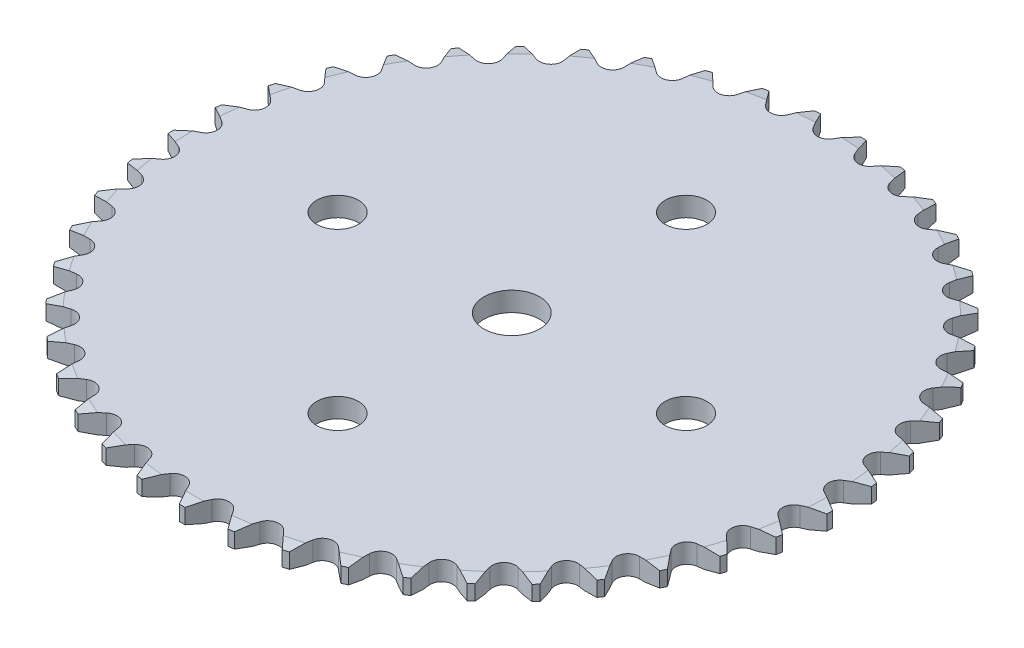
from build123d import *

# Parameters (mm, degrees)
CUT_EXTRUDE1_REACH = 71.565
CIRPATTERN1_START  = -2.794
CIRPATTERN1_DEPTH  = 2.794
SKETCH3_R          = 4
CUT_EXTRUDE2_DEPTH = 70.554033029
SKETCH4_R          = 25.4
CUT_EXTRUDE3_DEPTH = 16.256
SKETCH5_R          = 3
CUT_EXTRUDE4_DEPTH = 10


# Read off the part's stored shape, not the designer's step: CirPattern1
with BuildPart() as part:
    # Sketch1 → Revolve2 (revolve)
    with BuildSketch(Plane.XY, mode=Mode.PRIVATE) as revolve2_sk:
        Polygon((0, 0), (45.515488808, 0), (47.309615365, -0.316352919), (47.309615365, -2.477647081), (45.515488808, -2.794), (25.4, -2.794), (25.4, -18.55), (24.9, -19.05), (0, -19.05), align=None)
    revolve(revolve2_sk.sketch.rotate(Axis((0, 0, 0), (0, -1, 0)), 180), axis=Axis((0, 0, 0), (0, -1, 0)))

    # Cut-Extrude1: up to this face of the body (flat: up to its plane)
    cut_extrude1_end = Plane(part.part.faces().sort_by_distance((44.228116377, -2.794, 0))[0])
    # Sketch2 → Cut-Extrude1 (cut, up to the picked face)
    with BuildSketch(Plane(origin=(0, 0, 0), x_dir=(1, 0, 0), z_dir=(0, 1, 0)), mode=Mode.PRIVATE) as cut_extrude1_sk1:
        with BuildLine():
            Line((1.428941916, 44.690488808), (2.890081741, 47.221257221))
            ThreePointArc((2.890081741, 47.221257221), (0, 47.309615365), (-2.890081741, 47.221257221))
            Line((-2.890081741, 47.221257221), (-1.428941916, 44.690488808))
            ThreePointArc((-1.428941916, 44.690488808), (0, 43.865488808), (1.428941916, 44.690488808))
        make_face()
    cut_extrude1_tool1 = split(extrude(cut_extrude1_sk1.sketch, amount=-CUT_EXTRUDE1_REACH, mode=Mode.PRIVATE), bisect_by=cut_extrude1_end, keep=Keep.BOTH, mode=Mode.PRIVATE)
    add(cut_extrude1_tool1.solids().sort_by(Axis((0, 0, -45.903425), (0, -1, 0)))[0], mode=Mode.SUBTRACT)

    # CirPattern1 outline → CirPattern1 (cut)
    with BuildSketch(Plane(origin=(0, 0, 0), x_dir=(1, 0, 0), z_dir=(0, 1, 0)).offset(CIRPATTERN1_START)):
        with BuildLine():
            ThreePointArc((-42.339849222, -21.107744404), (-40.971328749, -23.654807683), (-39.449767482, -26.113512817))
            Line((-39.449767482, -26.113512817), (-37.988627657, -23.582744404))
            ThreePointArc((-37.988627657, -23.582744404), (-37.988627657, -21.932744404), (-39.417569574, -21.107744404))
            Line((-39.417569574, -21.107744404), (-42.339849222, -21.107744404))
        make_face()
        with BuildLine():
            ThreePointArc((-3.709973135, 47.16392483), (-6.584225875, 46.849201441), (-9.433884462, 46.359481554))
            Line((-9.433884462, 46.359481554), (-7.634749463, 44.056693766))
            ThreePointArc((-7.634749463, 44.056693766), (-6.104896103, 43.438592886), (-4.804678359, 44.454434321))
            Line((-4.804678359, 44.454434321), (-3.709973135, 47.16392483))
        make_face()
        with BuildLine():
            ThreePointArc((-10.237817603, 46.18860029), (-13.040297284, 45.4769211), (-15.794067354, 44.595371312))
            Line((-15.794067354, 44.595371312), (-13.691955295, 42.565385293))
            ThreePointArc((-13.691955295, 42.565385293), (-12.090967347, 42.166214165), (-10.944781035, 43.353124835))
            Line((-10.944781035, 43.353124835), (-10.237817603, 46.18860029))
        make_face()
        with BuildLine():
            ThreePointArc((-16.566394598, 44.314267184), (-19.242554139, 43.21948422), (-21.84683669, 41.963262893))
            Line((-21.84683669, 41.963262893), (-19.482662792, 40.245590012))
            ThreePointArc((-19.482662792, 40.245590012), (-17.841701664, 40.073118048), (-16.871855998, 41.407996089))
            Line((-16.871855998, 41.407996089), (-16.566394598, 44.314267184))
        make_face()
        with BuildLine():
            ThreePointArc((-22.572525565, 41.577407274), (-25.070276566, 40.12082924), (-27.474382201, 38.514387295))
            Line((-27.474382201, 38.514387295), (-24.894162419, 37.142460101))
            ThreePointArc((-24.894162419, 37.142460101), (-23.245167554, 37.200044271), (-22.470539476, 38.656907799))
            Line((-22.470539476, 38.656907799), (-22.572525565, 41.577407274))
        make_face()
        with BuildLine():
            ThreePointArc((-28.139307998, 38.031290425), (-30.410034576, 36.241267956), (-32.567170113, 34.315872957))
            Line((-32.567170113, 34.315872957), (-29.821125491, 33.316394453))
            ThreePointArc((-29.821125491, 33.316394453), (-28.196192698, 33.602913946), (-27.631859462, 35.153406771))
            Line((-27.631859462, 35.153406771), (-28.139307998, 38.031290425))
        make_face()
        with BuildLine():
            ThreePointArc((-33.158390809, 33.744937768), (-35.157895854, 31.656311616), (-37.026075104, 29.449439187))
            Line((-37.026075104, 29.449439187), (-34.167654277, 28.841863084))
            ThreePointArc((-34.167654277, 28.841863084), (-32.598411025, 29.351741124), (-32.255356735, 30.965684666))
            Line((-32.255356735, 30.965684666), (-33.158390809, 33.744937768))
        make_face()
        with BuildLine():
            ThreePointArc((-37.53208326, 28.801778282), (-39.221448681, 26.455201178), (-40.764309659, 24.00980558))
            Line((-40.764309659, 24.00980558), (-37.849148537, 23.805957657))
            ThreePointArc((-37.849148537, 23.805957657), (-36.36613836, 24.529270049), (-36.251040179, 26.175250732))
            Line((-36.251040179, 26.175250732), (-37.53208326, 28.801778282))
        make_face()
        with BuildLine():
            ThreePointArc((-41.175256402, 23.298024942), (-42.521600623, 20.739170342), (-43.709113296, 18.102848419))
            Line((-43.709113296, 18.102848419), (-40.793952174, 18.306696343))
            ThreePointArc((-40.793952174, 18.306696343), (-39.426040179, 19.229364633), (-39.54113836, 20.875345316))
            Line((-39.54113836, 20.875345316), (-41.175256402, 23.298024942))
        make_face()
        with BuildLine():
            ThreePointArc((-44.017000015, 17.340802049), (-44.994117976, 14.619475145), (-45.803168761, 11.843539905))
            Line((-45.803168761, 11.843539905), (-42.944747934, 12.451116008))
            ThreePointArc((-42.944747934, 12.451116008), (-41.718558972, 13.555181509), (-42.061613261, 15.16912505))
            Line((-42.061613261, 15.16912505), (-44.017000015, 17.340802049))
        make_face()
        with BuildLine():
            ThreePointArc((-46.002002791, 11.046060169), (-46.590876004, 8.215228495), (-47.005717646, 5.353710359))
            Line((-47.005717646, 5.353710359), (-44.259673024, 6.353188863))
            ThreePointArc((-44.259673024, 6.353188863), (-43.199073468, 7.617162194), (-43.763406704, 9.167655018))
            Line((-43.763406704, 9.167655018), (-46.002002791, 11.046060169))
        make_face()
        with BuildLine():
            ThreePointArc((-47.091628909, 4.536319292), (-47.280795626, 1.651081766), (-47.293353705, -1.24032307))
            Line((-47.293353705, -1.24032307), (-44.713133924, 0.131604123))
            ThreePointArc((-44.713133924, 0.131604123), (-43.838767138, 1.530883482), (-44.613395216, 2.98774701))
            Line((-44.613395216, 2.98774701), (-47.091628909, 4.536319292))
        make_face()
        with BuildLine():
            ThreePointArc((-47.264670036, -2.06171588), (-47.050448342, -4.945201392), (-46.66047843, -7.810215021))
            Line((-46.66047843, -7.810215021), (-44.296304532, -6.092542141))
            ThreePointArc((-44.296304532, -6.092542141), (-43.625189071, -4.585192136), (-44.595034737, -3.250314095))
            Line((-44.595034737, -3.250314095), (-47.264670036, -2.06171588))
        make_face()
        with BuildLine():
            ThreePointArc((-46.517758124, -8.619622098), (-45.9043176, -11.445231829), (-45.119410018, -14.228090021))
            Line((-45.119410018, -14.228090021), (-43.017297959, -12.198104002))
            ThreePointArc((-43.017297959, -12.198104002), (-42.562496322, -10.612022204), (-43.708682633, -9.425111533))
            Line((-43.708682633, -9.425111533), (-46.517758124, -8.619622098))
        make_face()
        with BuildLine():
            ThreePointArc((-44.865430963, -15.009757176), (-43.864711532, -17.722493848), (-42.700143612, -20.369031433))
            Line((-42.700143612, -20.369031433), (-40.901008612, -18.066243644))
            ThreePointArc((-40.901008612, -18.066243644), (-40.671372996, -16.432301331), (-41.971590739, -15.416459897))
            Line((-41.971590739, -15.416459897), (-44.865430963, -15.009757176))
        make_face()
        with BuildLine():
            Line((7.634749463, 44.056693766), (9.433884462, 46.359481554))
            ThreePointArc((9.433884462, 46.359481554), (6.584225875, 46.849201441), (3.709973135, 47.16392483))
            Line((3.709973135, 47.16392483), (4.804678359, 44.454434321))
            ThreePointArc((4.804678359, 44.454434321), (6.104896103, 43.438592886), (7.634749463, 44.056693766))
        make_face()
        with BuildLine():
            Line((13.691955295, 42.565385293), (15.794067354, 44.595371312))
            ThreePointArc((15.794067354, 44.595371312), (13.040297284, 45.4769211), (10.237817603, 46.18860029))
            Line((10.237817603, 46.18860029), (10.944781035, 43.353124835))
            ThreePointArc((10.944781035, 43.353124835), (12.090967347, 42.166214165), (13.691955295, 42.565385293))
        make_face()
        with BuildLine():
            Line((19.482662792, 40.245590012), (21.84683669, 41.963262893))
            ThreePointArc((21.84683669, 41.963262893), (19.242554139, 43.21948422), (16.566394598, 44.314267184))
            Line((16.566394598, 44.314267184), (16.871855998, 41.407996089))
            ThreePointArc((16.871855998, 41.407996089), (17.841701664, 40.073118048), (19.482662792, 40.245590012))
        make_face()
        with BuildLine():
            Line((24.894162419, 37.142460101), (27.474382201, 38.514387295))
            ThreePointArc((27.474382201, 38.514387295), (25.070276566, 40.12082924), (22.572525565, 41.577407274))
            Line((22.572525565, 41.577407274), (22.470539476, 38.656907799))
            ThreePointArc((22.470539476, 38.656907799), (23.245167554, 37.200044271), (24.894162419, 37.142460101))
        make_face()
        with BuildLine():
            Line((29.821125491, 33.316394453), (32.567170113, 34.315872957))
            ThreePointArc((32.567170113, 34.315872957), (30.410034576, 36.241267956), (28.139307998, 38.031290425))
            Line((28.139307998, 38.031290425), (27.631859462, 35.153406771))
            ThreePointArc((27.631859462, 35.153406771), (28.196192698, 33.602913946), (29.821125491, 33.316394453))
        make_face()
        with BuildLine():
            Line((34.167654277, 28.841863084), (37.026075104, 29.449439187))
            ThreePointArc((37.026075104, 29.449439187), (35.157895854, 31.656311616), (33.158390809, 33.744937768))
            Line((33.158390809, 33.744937768), (32.255356735, 30.965684666))
            ThreePointArc((32.255356735, 30.965684666), (32.598411025, 29.351741124), (34.167654277, 28.841863084))
        make_face()
        with BuildLine():
            Line((37.849148537, 23.805957657), (40.764309659, 24.00980558))
            ThreePointArc((40.764309659, 24.00980558), (39.221448681, 26.455201178), (37.53208326, 28.801778282))
            Line((37.53208326, 28.801778282), (36.251040179, 26.175250732))
            ThreePointArc((36.251040179, 26.175250732), (36.36613836, 24.529270049), (37.849148537, 23.805957657))
        make_face()
        with BuildLine():
            Line((40.793952174, 18.306696343), (43.709113296, 18.102848419))
            ThreePointArc((43.709113296, 18.102848419), (42.521600623, 20.739170342), (41.175256402, 23.298024942))
            Line((41.175256402, 23.298024942), (39.54113836, 20.875345316))
            ThreePointArc((39.54113836, 20.875345316), (39.426040179, 19.229364633), (40.793952174, 18.306696343))
        make_face()
        with BuildLine():
            Line((42.944747934, 12.451116008), (45.803168761, 11.843539905))
            ThreePointArc((45.803168761, 11.843539905), (44.994117976, 14.619475145), (44.017000015, 17.340802049))
            Line((44.017000015, 17.340802049), (42.061613261, 15.16912505))
            ThreePointArc((42.061613261, 15.16912505), (41.718558972, 13.555181509), (42.944747934, 12.451116008))
        make_face()
        with BuildLine():
            Line((44.259673024, 6.353188863), (47.005717646, 5.353710359))
            ThreePointArc((47.005717646, 5.353710359), (46.590876004, 8.215228495), (46.002002791, 11.046060169))
            Line((46.002002791, 11.046060169), (43.763406704, 9.167655018))
            ThreePointArc((43.763406704, 9.167655018), (43.199073468, 7.617162194), (44.259673024, 6.353188863))
        make_face()
        with BuildLine():
            Line((44.713133924, 0.131604123), (47.293353705, -1.24032307))
            ThreePointArc((47.293353705, -1.24032307), (47.280795626, 1.651081766), (47.091628909, 4.536319292))
            Line((47.091628909, 4.536319292), (44.613395216, 2.98774701))
            ThreePointArc((44.613395216, 2.98774701), (43.838767138, 1.530883482), (44.713133924, 0.131604123))
        make_face()
        with BuildLine():
            Line((44.296304532, -6.092542141), (46.66047843, -7.810215021))
            ThreePointArc((46.66047843, -7.810215021), (47.050448342, -4.945201392), (47.264670036, -2.06171588))
            Line((47.264670036, -2.06171588), (44.595034737, -3.250314095))
            ThreePointArc((44.595034737, -3.250314095), (43.625189071, -4.585192136), (44.296304532, -6.092542141))
        make_face()
        with BuildLine():
            Line((43.017297959, -12.198104002), (45.119410018, -14.228090021))
            ThreePointArc((45.119410018, -14.228090021), (45.9043176, -11.445231829), (46.517758124, -8.619622098))
            Line((46.517758124, -8.619622098), (43.708682633, -9.425111533))
            ThreePointArc((43.708682633, -9.425111533), (42.562496322, -10.612022204), (43.017297959, -12.198104002))
        make_face()
        with BuildLine():
            Line((40.901008612, -18.066243644), (42.700143612, -20.369031433))
            ThreePointArc((42.700143612, -20.369031433), (43.864711532, -17.722493848), (44.865430963, -15.009757176))
            Line((44.865430963, -15.009757176), (41.971590739, -15.416459897))
            ThreePointArc((41.971590739, -15.416459897), (40.671372996, -16.432301331), (40.901008612, -18.066243644))
        make_face()
        with BuildLine():
            Line((37.988627657, -23.582744404), (39.449767482, -26.113512817))
            ThreePointArc((39.449767482, -26.113512817), (40.971328749, -23.654807683), (42.339849222, -21.107744404))
            Line((42.339849222, -21.107744404), (39.417569574, -21.107744404))
            ThreePointArc((39.417569574, -21.107744404), (37.988627657, -21.932744404), (37.988627657, -23.582744404))
        make_face()
        with BuildLine():
            Line((34.336841276, -28.640233869), (35.431546501, -31.349724378))
            ThreePointArc((35.431546501, -31.349724378), (37.280485657, -29.126707593), (38.990170477, -26.794893397))
            Line((38.990170477, -26.794893397), (36.096330253, -26.388190676))
            ThreePointArc((36.096330253, -26.388190676), (34.566476893, -27.006291556), (34.336841276, -28.640233869))
        make_face()
        with BuildLine():
            Line((30.016727338, -33.140273759), (30.72369077, -35.975749213))
            ThreePointArc((30.72369077, -35.975749213), (32.864020316, -34.031689271), (34.881592414, -31.960510269))
            Line((34.881592414, -31.960510269), (32.072516923, -31.155020833))
            ThreePointArc((32.072516923, -31.155020833), (30.471528975, -31.554191961), (30.016727338, -33.140273759))
        make_face()
        with BuildLine():
            Line((25.112371945, -36.995275918), (25.417833346, -39.901547012))
            ThreePointArc((25.417833346, -39.901547012), (27.807894203, -38.274282828), (30.094083832, -36.504052162))
            Line((30.094083832, -36.504052162), (27.424448533, -35.315453948))
            ThreePointArc((27.424448533, -35.315453948), (25.783487405, -35.487925912), (25.112371945, -36.995275918))
        make_face()
        with BuildLine():
            Line((19.719232797, -40.130207111), (19.617246708, -43.050706586))
            ThreePointArc((19.617246708, -43.050706586), (22.21051906, -41.771911006), (24.72082814, -40.337084204))
            Line((24.72082814, -40.337084204), (22.242594448, -38.788511922))
            ThreePointArc((22.242594448, -38.788511922), (20.593599583, -38.730927753), (19.719232797, -40.130207111))
        make_face()
        with BuildLine():
            Line((13.942281213, -42.484049471), (13.434832678, -45.361933126))
            ThreePointArc((13.434832678, -45.361933126), (16.180841428, -44.456496451), (18.866409648, -43.385000784))
            Line((18.866409648, -43.385000784), (16.627813562, -41.506595633))
            ThreePointArc((16.627813562, -41.506595633), (15.002880769, -41.22007614), (13.942281213, -42.484049471))
        make_face()
        with BuildLine():
            Line((7.893958985, -44.010988133), (6.990924911, -46.790241235))
            ThreePointArc((6.990924911, -46.790241235), (9.836222123, -46.275786761), (12.644777952, -45.588477673))
            Line((12.644777952, -45.588477673), (10.689391199, -43.416800673))
            ThreePointArc((10.689391199, -43.416800673), (9.120147947, -42.906922633), (7.893958985, -44.010988133))
        make_face()
        with BuildLine():
            Line((1.691989824, -44.681302973), (0.410946743, -47.307830523))
            ThreePointArc((0.410946743, -47.307830523), (3.300151942, -47.19437152), (6.177030036, -46.904626701))
            Line((6.177030036, -46.904626701), (4.542911995, -44.481947074))
            ThreePointArc((4.542911995, -44.481947074), (3.059901819, -43.758634682), (1.691989824, -44.681302973))
        make_face()
        with BuildLine():
            Line((-4.542911995, -44.481947074), (-6.177030036, -46.904626701))
            ThreePointArc((-6.177030036, -46.904626701), (-3.300151942, -47.19437152), (-0.410946743, -47.307830523))
            Line((-0.410946743, -47.307830523), (-1.691989824, -44.681302973))
            ThreePointArc((-1.691989824, -44.681302973), (-3.059901819, -43.758634682), (-4.542911995, -44.481947074))
        make_face()
        with BuildLine():
            Line((-10.689391199, -43.416800673), (-12.644777952, -45.588477673))
            ThreePointArc((-12.644777952, -45.588477673), (-9.836222123, -46.275786761), (-6.990924911, -46.790241235))
            Line((-6.990924911, -46.790241235), (-7.893958985, -44.010988133))
            ThreePointArc((-7.893958985, -44.010988133), (-9.120147947, -42.906922633), (-10.689391199, -43.416800673))
        make_face()
        with BuildLine():
            Line((-16.627813562, -41.506595633), (-18.866409648, -43.385000784))
            ThreePointArc((-18.866409648, -43.385000784), (-16.180841428, -44.456496451), (-13.434832678, -45.361933126))
            Line((-13.434832678, -45.361933126), (-13.942281213, -42.484049471))
            ThreePointArc((-13.942281213, -42.484049471), (-15.002880769, -41.22007614), (-16.627813562, -41.506595633))
        make_face()
        with BuildLine():
            Line((-22.242594448, -38.788511922), (-24.72082814, -40.337084204))
            ThreePointArc((-24.72082814, -40.337084204), (-22.21051906, -41.771911006), (-19.617246708, -43.050706586))
            Line((-19.617246708, -43.050706586), (-19.719232797, -40.130207111))
            ThreePointArc((-19.719232797, -40.130207111), (-20.593599583, -38.730927753), (-22.242594448, -38.788511922))
        make_face()
        with BuildLine():
            Line((-27.424448533, -35.315453948), (-30.094083832, -36.504052162))
            ThreePointArc((-30.094083832, -36.504052162), (-27.807894203, -38.274282828), (-25.417833346, -39.901547012))
            Line((-25.417833346, -39.901547012), (-25.112371945, -36.995275918))
            ThreePointArc((-25.112371945, -36.995275918), (-25.783487405, -35.487925912), (-27.424448533, -35.315453948))
        make_face()
        with BuildLine():
            Line((-32.072516923, -31.155020833), (-34.881592414, -31.960510269))
            ThreePointArc((-34.881592414, -31.960510269), (-32.864020316, -34.031689271), (-30.72369077, -35.975749213))
            Line((-30.72369077, -35.975749213), (-30.016727338, -33.140273759))
            ThreePointArc((-30.016727338, -33.140273759), (-30.471528975, -31.554191961), (-32.072516923, -31.155020833))
        make_face()
        with BuildLine():
            Line((-36.096330253, -26.388190676), (-38.990170477, -26.794893397))
            ThreePointArc((-38.990170477, -26.794893397), (-37.280485657, -29.126707593), (-35.431546501, -31.349724378))
            Line((-35.431546501, -31.349724378), (-34.336841276, -28.640233869))
            ThreePointArc((-34.336841276, -28.640233869), (-34.566476893, -27.006291556), (-36.096330253, -26.388190676))
        make_face()
    extrude(amount=CIRPATTERN1_DEPTH, mode=Mode.SUBTRACT)

    # Sketch3 → Cut-Extrude2 (cut, through all)
    with BuildSketch(Plane.XZ.offset(19.05)):
        Circle(SKETCH3_R)
    extrude(amount=-CUT_EXTRUDE2_DEPTH, mode=Mode.SUBTRACT)

    # Sketch4 → Cut-Extrude3 (cut)
    with BuildSketch(Plane.XZ.offset(19.05)):
        Circle(SKETCH4_R)
    extrude(amount=-CUT_EXTRUDE3_DEPTH, mode=Mode.SUBTRACT)

    # Sketch5 → Cut-Extrude4 (cut)
    with BuildSketch(Plane.XZ.offset(2.794)):
        with Locations((0, 25)):
            Circle(SKETCH5_R)
        with Locations((25, 0)):
            Circle(SKETCH5_R)
        with Locations((0, -25)):
            Circle(SKETCH5_R)
        with Locations((-25, 0)):
            Circle(SKETCH5_R)
    extrude(amount=-CUT_EXTRUDE4_DEPTH, mode=Mode.SUBTRACT)


solid = part.part
